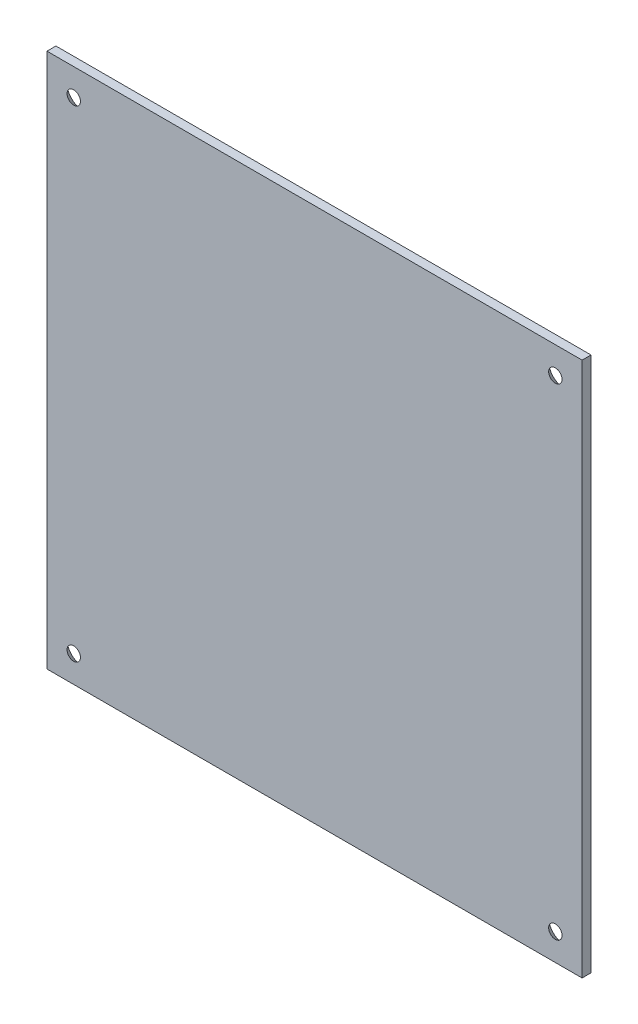
from build123d import *

# Parameters (mm, degrees)
SKETCH1_W           = 120
SKETCH1_H           = 120
BOSS_EXTRUDE1_DEPTH = 2
SKETCH2_R           = 1.5
CUT_EXTRUDE1_DEPTH  = 3
CHAMFER1_SIZE       = 2


with BuildPart() as part:
    # Sketch1 → Boss-Extrude1 (new body)
    with BuildSketch(Plane.XY):
        with Locations((34.39590661, -45.309126743)):
            Rectangle(SKETCH1_W, SKETCH1_H)
    extrude(amount=BOSS_EXTRUDE1_DEPTH)

    # Sketch2 → Cut-Extrude1 (cut)
    with BuildSketch(Plane(origin=(0, 0, 0), x_dir=(-1, 0, 0), z_dir=(0, 0, -1))):
        with Locations((-88.39590661, -99.309126743)):
            Circle(SKETCH2_R)
        with Locations(Location((19.60409339, -99.309126743, 0), (0, 0, 180))):
            Circle(SKETCH2_R)
        with Locations((19.60409339, 8.690873257)):
            Circle(SKETCH2_R)
        with Locations(Location((-88.39590661, 8.690873257, 0), (0, 0, 180))):
            Circle(SKETCH2_R)
    extrude(amount=-CUT_EXTRUDE1_DEPTH, mode=Mode.SUBTRACT)

    # Chamfer1
    chamfer1_edges = [part.edges().sort_by_distance(p)[0] for p in [
        (89.89590661, -99.309126743, 0),
        (-21.10409339, -99.309126743, 0),
        (-18.10409339, 8.690873257, 0),
        (86.89590661, 8.690873257, 0),
    ]]
    chamfer(chamfer1_edges, length=CHAMFER1_SIZE - 0.0001)  # a hair under: the kernel refuses the full size


solid = part.part
